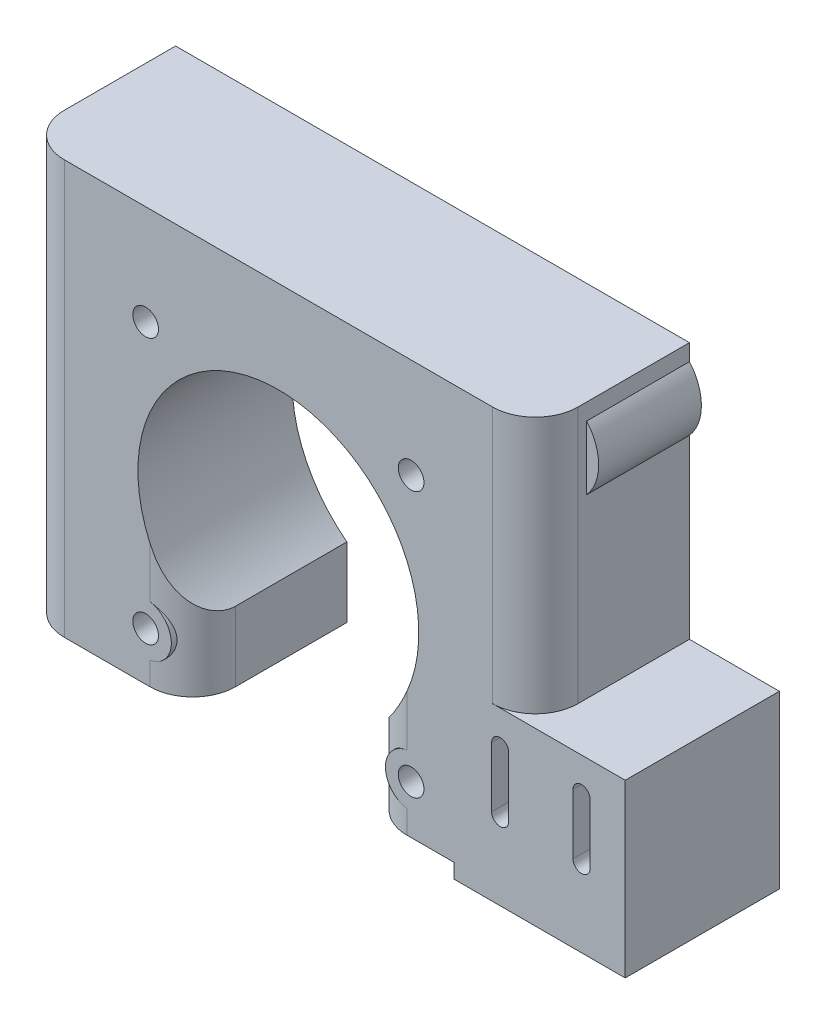
from build123d import *

# Parameters (mm, degrees)
SKETCH_1_R          = 1.5
EXTRUDE_1_DEPTH     = 18
SKETCH_9_W          = 60
SKETCH_9_H          = 18
EXTRUDE_4_DEPTH     = 6
FILLET_1_R          = 5
EXTRUDE_START       = -4
SKETCH_2_R          = 3
SKETCH_2_R_2        = 1.5
EXTRUDE_2_DEPTH     = 4
SKETCH_3_R          = 1.5
CUT_EXTRUDE_1_DEPTH = 8
EXTRUDE_3_REACH     = 48.414
SKETCH_5_W          = 20
SKETCH_5_H          = 20
SKETCH_6_R          = 1.5
CUT_EXTRUDE_6_DEPTH = 8
CUT_EXTRUDE_7_DEPTH = 6
CUT_EXTRUDE_START   = -4
CUT_EXTRUDE_8_DEPTH = 3
SKETCH_10_R         = 5.65
SKETCH_10_R_2       = 4.041451884
EXTRUDE_5_DEPTH     = 12
SKETCH_11_R         = 2
CUT_EXTRUDE_9_DEPTH = 10


with BuildPart() as part:
    # Эскиз1 → Бобышка-Вытянуть1 (new body)
    with BuildSketch(Plane.XY):
        with BuildLine():
            Line((10, -17.8), (30, -17.8))
            Line((30, -17.8), (30, 24.5))
            Line((30, 24.5), (-30, 24.5))
            Line((-30, 24.5), (-30, -17.8))
            Line((-30, -17.8), (-10, -17.8))
            Line((-10, -17.8), (-10, -9.648461447))
            ThreePointArc((-10, -9.648461447), (0, 19.75), (10, -9.648461447))
            Line((10, -9.648461447), (10, -17.8))
        make_face()
        with Locations((-15.5, -12.15)):
            Circle(SKETCH_1_R, mode=Mode.SUBTRACT)
        with Locations((15.5, -12.15)):
            Circle(SKETCH_1_R, mode=Mode.SUBTRACT)
        with Locations((-15.5, 18.85)):
            Circle(SKETCH_1_R, mode=Mode.SUBTRACT)
        with Locations((15.5, 18.85)):
            Circle(SKETCH_1_R, mode=Mode.SUBTRACT)
    extrude(amount=EXTRUDE_1_DEPTH)

    # Эскиз9 → Бобышка-Вытянуть4 (add)
    with BuildSketch(Plane(origin=(0, 24.5, 0), x_dir=(1, 0, 0), z_dir=(0, 1, 0))):
        with Locations((0, -9)):
            Rectangle(SKETCH_9_W, SKETCH_9_H)
    extrude(amount=EXTRUDE_4_DEPTH)

    # Скругление1
    # the kernel refuses this fillet: 5 mm, written as the material it takes off along each edge
    with BuildSketch(Plane(origin=(10, 2.851538553, 18), x_dir=(1, 0, 0), z_dir=(0, -1, 0)), Plane(origin=(-10, -30.3, 18), x_dir=(-1, 0, 0), z_dir=(0, 1, 0))) as fillet_1_piece_1:
        with BuildLine():
            CenterArc((FILLET_1_R, -FILLET_1_R), FILLET_1_R, 90, 90)
            Line((0, -FILLET_1_R), (0, 0))
            Line((0, 0), (FILLET_1_R, 0))
        make_face()
    extrude(amount=33.151538553, mode=Mode.SUBTRACT)
    with BuildSketch(Plane(origin=(30, -30.3, 18), x_dir=(-1, 0, 0), z_dir=(0, 1, 0)), Plane(origin=(-30, 43, 18), x_dir=(1, 0, 0), z_dir=(0, -1, 0))) as fillet_1_piece_2:
        with BuildLine():
            CenterArc((FILLET_1_R, -FILLET_1_R), FILLET_1_R, 90, 90)
            Line((0, -FILLET_1_R), (0, 0))
            Line((0, 0), (FILLET_1_R, 0))
        make_face()
    extrude(amount=73.3, mode=Mode.SUBTRACT)

    # Эскиз2 → Бобышка-Вытянуть2 (add)
    # profile 1 of 2: a face of its own
    with BuildSketch(Plane.XY.offset(18).offset(EXTRUDE_START)):
        with Locations((-15.5, -12.15)):
            Circle(SKETCH_2_R)
        with Locations((-15.5, -12.15)):
            Circle(SKETCH_2_R_2, mode=Mode.SUBTRACT)
    # profile 2 of 2: a face of its own
    with BuildSketch(Plane.XY.offset(18).offset(EXTRUDE_START)):
        with Locations((15.5, -12.15)):
            Circle(SKETCH_2_R)
        with Locations((15.5, -12.15)):
            Circle(SKETCH_2_R_2, mode=Mode.SUBTRACT)
    extrude(amount=EXTRUDE_2_DEPTH)

    # Эскиз3 → Вырез-Вытянуть1 (cut)
    with BuildSketch(Plane.XZ.offset(17.8)):
        with Locations(Location((-21, 12.5, 0), (0, 0, 270))):
            Circle(SKETCH_3_R)
        with Locations(Location((21, 12.5, 0), (0, 0, 270))):
            Circle(SKETCH_3_R)
    extrude(amount=-CUT_EXTRUDE_1_DEPTH, mode=Mode.SUBTRACT)

    # Бобышка-Вытянуть3: up to this face of the body (flat: up to its plane)
    extrude_3_end = Plane(part.part.faces().sort_by_distance((0, 20.520252556, 0))[0])
    # Эскиз5 → Бобышка-Вытянуть3 (add, up to the picked face)
    with BuildSketch(Plane.XY.offset(18), mode=Mode.PRIVATE) as extrude_3_sk1:
        with Locations((30.5, -9.5)):
            Rectangle(SKETCH_5_W, SKETCH_5_H)
    extrude_3_tool1 = split(extrude(extrude_3_sk1.sketch, amount=-EXTRUDE_3_REACH, mode=Mode.PRIVATE), bisect_by=extrude_3_end, keep=Keep.BOTH, mode=Mode.PRIVATE)
    add(extrude_3_tool1.solids().sort_by(Axis((30.5, -9.5, 18), (0, 0, -1)))[0])

    # Эскиз6 → Вырез-Вытянуть6 (cut)
    with BuildSketch(Plane.XZ.offset(17.8)):
        with Locations(Location((21, 12.5, 0), (0, 0, 270))):
            Circle(SKETCH_6_R)
    extrude(amount=-CUT_EXTRUDE_6_DEPTH, mode=Mode.SUBTRACT)

    # Эскиз7 → Вырез-Вытянуть7 (cut)
    with BuildSketch(Plane.XY.offset(18)):
        with BuildLine():
            Line((24.9, -10.485784196), (24.9, -3.485784196))
            ThreePointArc((24.9, -3.485784196), (25.9, -2.485784196), (26.9, -3.485784196))
            Line((26.9, -3.485784196), (26.9, -10.485784196))
            ThreePointArc((26.9, -10.485784196), (25.9, -11.485784196), (24.9, -10.485784196))
        make_face()
        with BuildLine():
            Line((34.4, -10.485784196), (34.4, -3.485784196))
            ThreePointArc((34.4, -3.485784196), (35.4, -2.485784196), (36.4, -3.485784196))
            Line((36.4, -3.485784196), (36.4, -10.485784196))
            ThreePointArc((36.4, -10.485784196), (35.4, -11.485784196), (34.4, -10.485784196))
        make_face()
    extrude(amount=-CUT_EXTRUDE_7_DEPTH, mode=Mode.SUBTRACT)

    # Эскиз8 → Вырез-Вытянуть8 (cut)
    with BuildSketch(Plane(origin=(0, 0, 0), x_dir=(-1, 0, 0), z_dir=(0, 0, -1)).offset(CUT_EXTRUDE_START)):
        Polygon((29.791451884, -11.8), (27.770725942, -8.3), (23.729274058, -8.3), (21.708548116, -11.8), (23.729274058, -15.3), (27.770725942, -15.3), align=None)
        Polygon((-21.708548116, -11.8), (-23.729274058, -8.3), (-27.770725942, -8.3), (-29.791451884, -11.8), (-27.770725942, -15.3), (-23.729274058, -15.3), align=None)
        Polygon((-21.708548116, 24.85), (-23.729274058, 28.35), (-27.770725942, 28.35), (-29.791451884, 24.85), (-27.770725942, 21.35), (-23.729274058, 21.35), align=None)
        Polygon((29.791451884, 24.85), (27.770725942, 28.35), (23.729274058, 28.35), (21.708548116, 24.85), (23.729274058, 21.35), (27.770725942, 21.35), align=None)
    extrude(amount=-CUT_EXTRUDE_8_DEPTH, mode=Mode.SUBTRACT)

    # Эскиз10 → Бобышка-Вытянуть5 (add)
    # profile 1 of 4: a face of its own
    with BuildSketch(Plane(origin=(0, 0, 0), x_dir=(-1, 0, 0), z_dir=(0, 0, -1))):
        with Locations((25.75, -11.8)):
            Circle(SKETCH_10_R)
        with Locations((25.75, -11.8)):
            Circle(SKETCH_10_R_2, mode=Mode.SUBTRACT)
    # profile 2 of 4: a face of its own
    with BuildSketch(Plane(origin=(0, 0, 0), x_dir=(-1, 0, 0), z_dir=(0, 0, -1))):
        with Locations((25.75, 24.85)):
            Circle(SKETCH_10_R)
        with Locations((25.75, 24.85)):
            Circle(SKETCH_10_R_2, mode=Mode.SUBTRACT)
    # profile 3 of 4: a face of its own
    with BuildSketch(Plane(origin=(0, 0, 0), x_dir=(-1, 0, 0), z_dir=(0, 0, -1))):
        with Locations((-25.75, 24.85)):
            Circle(SKETCH_10_R)
        with Locations((-25.75, 24.85)):
            Circle(SKETCH_10_R_2, mode=Mode.SUBTRACT)
    # profile 4 of 4: a face of its own
    with BuildSketch(Plane(origin=(0, 0, 0), x_dir=(-1, 0, 0), z_dir=(0, 0, -1))):
        with Locations((-25.75, -11.8)):
            Circle(SKETCH_10_R)
        with Locations((-25.75, -11.8)):
            Circle(SKETCH_10_R_2, mode=Mode.SUBTRACT)
    extrude(amount=-EXTRUDE_5_DEPTH)

    # Эскиз11 → Вырез-Вытянуть9 (cut)
    with BuildSketch(Plane(origin=(0, 0, 0), x_dir=(-1, 0, 0), z_dir=(0, 0, -1))):
        with Locations((-25.75, 24.85)):
            Circle(SKETCH_11_R)
        with Locations((25.75, 24.85)):
            Circle(SKETCH_11_R)
        with Locations((25.75, -11.8)):
            Circle(SKETCH_11_R)
        with Locations((-25.75, -11.8)):
            Circle(SKETCH_11_R)
    extrude(amount=-CUT_EXTRUDE_9_DEPTH, mode=Mode.SUBTRACT)


solid = part.part
